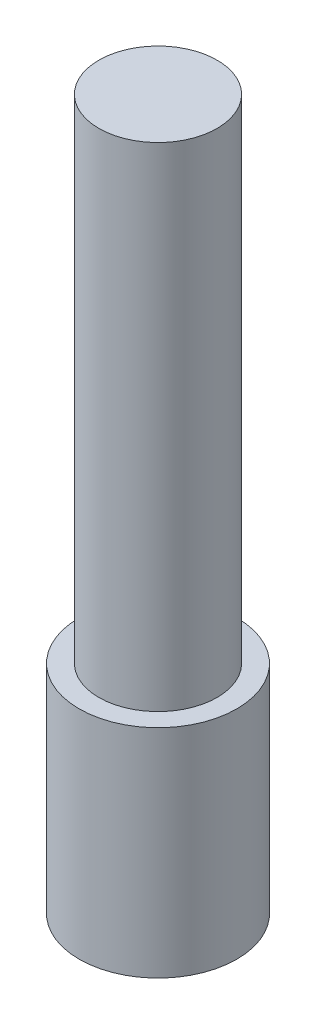
from build123d import *

# Parameters (mm, degrees)
SKETCH2_R           = 3
BOSS_EXTRUDE1_DEPTH = 25
SKETCH3_R           = 4
BOSS_EXTRUDE2_DEPTH = 11


with BuildPart() as part:
    # Sketch2 → Boss-Extrude1 (new body)
    with BuildSketch(Plane(origin=(0, 0, 0), x_dir=(1, 0, 0), z_dir=(0, 1, 0))):
        Circle(SKETCH2_R)
    extrude(amount=BOSS_EXTRUDE1_DEPTH)

    # Sketch3 → Boss-Extrude2 (add)
    with BuildSketch(Plane.XZ):
        Circle(SKETCH3_R)
    extrude(amount=BOSS_EXTRUDE2_DEPTH)


solid = part.part
